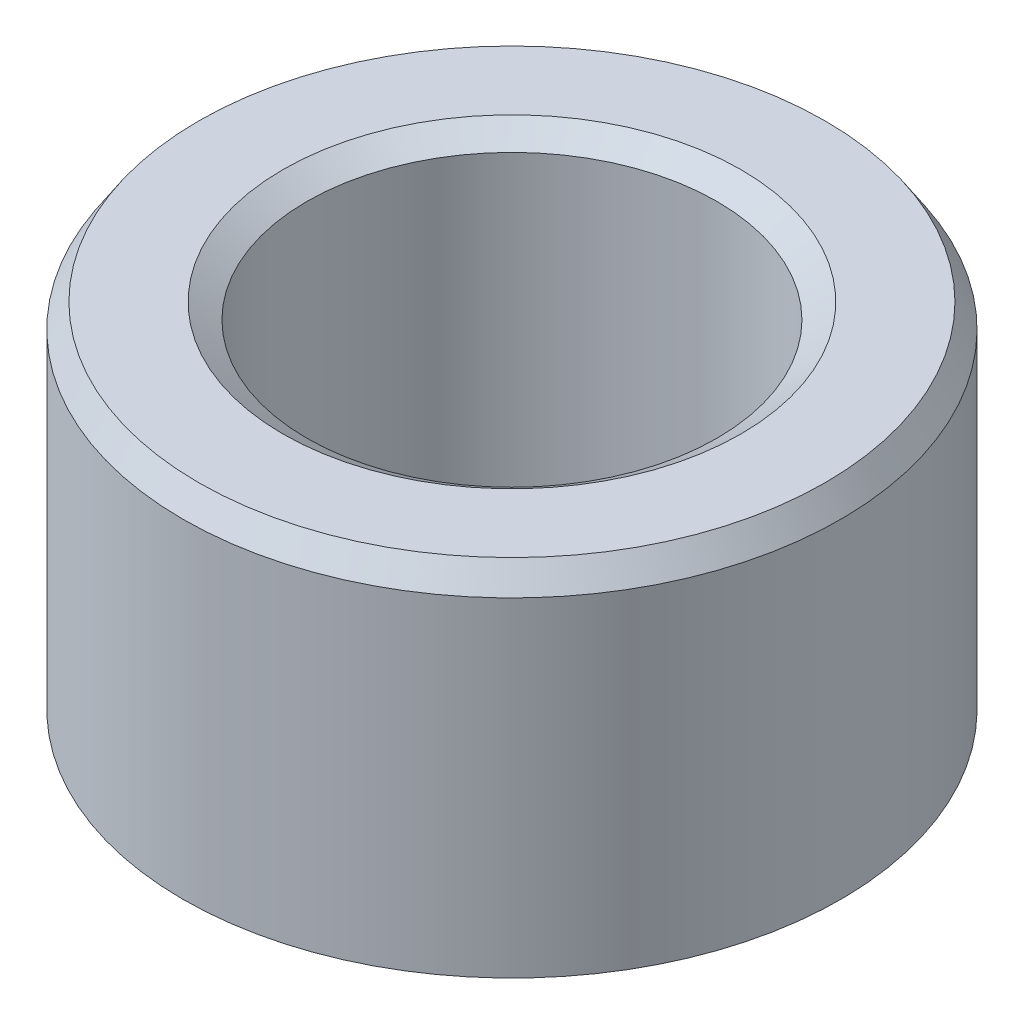
from build123d import *
from OCP.BRepFilletAPI import BRepFilletAPI_MakeChamfer

# Parameters (mm, degrees)
SKETCH1_R           = 47.5
BOSS_EXTRUDE1_DEPTH = 53.253125111
SKETCH2_R           = 29.619308067
CUT_EXTRUDE1_DEPTH  = 86.722781885
CHAMFER1_SIZE       = 3.45361466
CHAMFER1_SIZE2      = 2.255092639


with BuildPart() as part:
    # Sketch1 → Boss-Extrude1 (new body)
    with BuildSketch(Plane(origin=(0, 0, 0), x_dir=(1, 0, 0), z_dir=(0, 1, 0))):
        Circle(SKETCH1_R)
    extrude(amount=BOSS_EXTRUDE1_DEPTH)

    # Sketch2 → Cut-Extrude1 (cut, through all)
    with BuildSketch(Plane(origin=(0, 0, 0), x_dir=(1, 0, 0), z_dir=(0, 1, 0))):
        Circle(SKETCH2_R)
    extrude(amount=CUT_EXTRUDE1_DEPTH, mode=Mode.SUBTRACT)

    # Chamfer1: one chamfer whose edges measure the first distance from different faces: ONE call of the kernel's chamfer builder (chamfer() names one face for all edges)
    chamfer1_edges_1 = [part.edges().sort_by_distance(p)[0] for p in [
        (-29.619308067, 53.253125111, 0),
    ]]
    chamfer1_side_1 = [part.faces().sort_by_distance(p)[0] for p in [
        (-46.156497116, 53.253125111, 0),
    ]]
    chamfer1_edges_2 = [part.edges().sort_by_distance(p)[0] for p in [
        (-29.619308067, 0, 0),
    ]]
    chamfer1_side_2 = [part.faces().sort_by_distance(p)[0] for p in [
        (-29.619308067, 26.626562556, 0),
    ]]
    chamfer1_edges_3 = [part.edges().sort_by_distance(p)[0] for p in [
        (-47.5, 0, 0),
    ]]
    chamfer1_side_3 = [part.faces().sort_by_distance(p)[0] for p in [
        (-46.156497116, 0, 0),
    ]]
    chamfer1_edges_4 = [part.edges().sort_by_distance(p)[0] for p in [
        (-47.5, 53.253125111, 0),
    ]]
    chamfer1_side_4 = [part.faces().sort_by_distance(p)[0] for p in [
        (-47.5, 26.626562556, 0),
    ]]
    chamfer1 = BRepFilletAPI_MakeChamfer(part.part.solid().wrapped)
    for e in chamfer1_edges_1:
        chamfer1.Add(CHAMFER1_SIZE, CHAMFER1_SIZE2, e.wrapped, chamfer1_side_1[0].wrapped)  # the first distance lies on this face
    for e in chamfer1_edges_2:
        chamfer1.Add(CHAMFER1_SIZE, CHAMFER1_SIZE2, e.wrapped, chamfer1_side_2[0].wrapped)  # the first distance lies on this face
    for e in chamfer1_edges_3:
        chamfer1.Add(CHAMFER1_SIZE, CHAMFER1_SIZE2, e.wrapped, chamfer1_side_3[0].wrapped)  # the first distance lies on this face
    for e in chamfer1_edges_4:
        chamfer1.Add(CHAMFER1_SIZE, CHAMFER1_SIZE2, e.wrapped, chamfer1_side_4[0].wrapped)  # the first distance lies on this face
    add(Compound.cast(chamfer1.Shape()), mode=Mode.REPLACE)


solid = part.part
